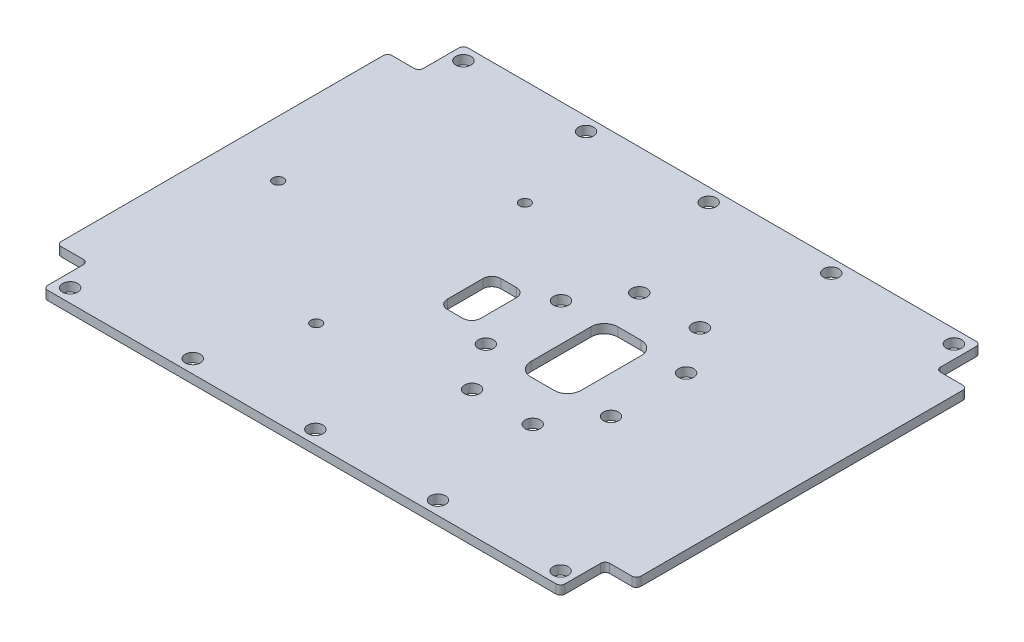
from build123d import *

# Parameters (mm, degrees)
SKETCH_1_W             = 130
SKETCH_1_H             = 94.2
SM_BASE_FLANGE_1_DEPTH = 2
HOLE_WIZARD_M3_1_D     = 3.4
HOLE_WIZARD_M3_2_D     = 3.4
CUT_EXTRUDE_1_REACH    = 82.296
CUT_EXTRUDE_2_REACH    = 82.296
SKETCH_10_W            = 7.464918405
SKETCH_10_H            = 12
FILLET_2_R             = 2
HOLE_WIZARD_M2_1_D     = 2.4
CUT_EXTRUDE_3_DEPTH    = 81.295765766
FILLET_3_R             = 1


# Sheet-metal steps are written as plain solids
with BuildPart() as part:
    # Sketch 1 → 基体-法兰1 (new body)
    with BuildSketch(Plane(origin=(0, 0, 0), x_dir=(1, 0, 0), z_dir=(0, 1, 0))):
        Rectangle(SKETCH_1_W, SKETCH_1_H)
    extrude(amount=-SM_BASE_FLANGE_1_DEPTH)

    # M3 间隙孔1 (through all)
    with Locations(Plane(origin=(0, 0, 0), x_dir=(1, 0, 0), z_dir=(0, 1, 0))):
        with Locations((-55, -44.1), (-27.5, -44.1), (0, -44.1), (27.5, -44.1), (55, -44.1), (55, 44.1), (27.5, 44.1), (0, 44.1), (-27.5, 44.1), (-55, 44.1)):
            Hole(HOLE_WIZARD_M3_1_D / 2)

    # M3 间隙孔2 (through all)
    with Locations(Plane(origin=(0, 0, 0), x_dir=(1, 0, 0), z_dir=(0, 1, 0))):
        with Locations((2.567531914, -8.425296044), (2.567531914, 8.425296044), (9.795, 18.75), (23.395, 18.75), (30.622468086, 8.425296044), (30.622468086, -8.425296044), (23.395, -18.75), (9.795, -18.75)):
            Hole(HOLE_WIZARD_M3_2_D / 2)

    # 草图8 → 切除-拉伸1 (cut, up to next)
    with BuildSketch(Plane(origin=(0, 0, 0), x_dir=(1, 0, 0), z_dir=(0, 1, 0)), mode=Mode.PRIVATE) as cut_extrude_1_sk1:
        with BuildLine():
            Line((19.22, 9.75), (13.97, 9.75))
            ThreePointArc((13.97, 9.75), (11.848679656, 8.871320344), (10.97, 6.75))
            Line((10.97, 6.75), (10.97, -6.75))
            ThreePointArc((10.97, -6.75), (11.848679656, -8.871320344), (13.97, -9.75))
            Line((13.97, -9.75), (19.22, -9.75))
            ThreePointArc((19.22, -9.75), (21.341320344, -8.871320344), (22.22, -6.75))
            Line((22.22, -6.75), (22.22, 6.75))
            ThreePointArc((22.22, 6.75), (21.341320344, 8.871320344), (19.22, 9.75))
        make_face()
    cut_extrude_1_tool1 = extrude(cut_extrude_1_sk1.sketch, amount=-CUT_EXTRUDE_1_REACH, mode=Mode.PRIVATE) & part.part
    add(cut_extrude_1_tool1.solids().sort_by_distance((16.595, 0, 0))[0], mode=Mode.SUBTRACT)

    # 草图10 → 切除-拉伸2 (cut, up to next)
    with BuildSketch(Plane(origin=(0, 0, 0), x_dir=(1, 0, 0), z_dir=(0, 1, 0)), mode=Mode.PRIVATE) as cut_extrude_2_sk1:
        with Locations((-6.762459203, 0)):
            Rectangle(SKETCH_10_W, SKETCH_10_H)
    cut_extrude_2_tool1 = extrude(cut_extrude_2_sk1.sketch, amount=-CUT_EXTRUDE_2_REACH, mode=Mode.PRIVATE) & part.part
    add(cut_extrude_2_tool1.solids().sort_by_distance((-6.762459, 0, 0))[0], mode=Mode.SUBTRACT)

    # 圆角2
    fillet_2_edges = [part.edges().sort_by_distance(p)[0] for p in [
        (-10.494918405, -1, 6),
        (-10.494918405, -1, -6),
        (-3.03, -1, -6),
        (-3.03, -1, 6),
    ]]
    fillet(fillet_2_edges, radius=FILLET_2_R)

    # M2 间隙孔1 (through all)
    with Locations(Plane(origin=(0, 0, 0), x_dir=(1, 0, 0), z_dir=(0, 1, 0))):
        with Locations((-20.514677996, 23.3999532), (-20.514677996, -23.3999532), (-52.431517644, 0)):
            Hole(HOLE_WIZARD_M2_1_D / 2)

    # 草图14 → 切除-拉伸3 (cut, through all)
    with BuildSketch(Plane(origin=(0, 0, 0), x_dir=(1, 0, 0), z_dir=(0, 1, 0))):
        with BuildLine():
            Line((-65, 47.1), (-58, 47.1))
            Line((-58, 47.1), (-58, 38.1))
            ThreePointArc((-58, 38.1), (-58.292893219, 37.392893219), (-59, 37.1))
            Line((-59, 37.1), (-65, 37.1))
            Line((-65, 37.1), (-65, 47.1))
        make_face()
        with BuildLine():
            Line((-58, -47.1), (-58, -38.1))
            ThreePointArc((-58, -38.1), (-58.292893219, -37.392893219), (-59, -37.1))
            Line((-59, -37.1), (-65, -37.1))
            Line((-65, -37.1), (-65, -47.1))
            Line((-65, -47.1), (-58, -47.1))
        make_face()
        with BuildLine():
            Line((65, -47.1), (58, -47.1))
            Line((58, -47.1), (58, -38.1))
            ThreePointArc((58, -38.1), (58.292893219, -37.392893219), (59, -37.1))
            Line((59, -37.1), (65, -37.1))
            Line((65, -37.1), (65, -47.1))
        make_face()
        with BuildLine():
            Line((58, 47.1), (58, 38.1))
            ThreePointArc((58, 38.1), (58.292893219, 37.392893219), (59, 37.1))
            Line((59, 37.1), (65, 37.1))
            Line((65, 37.1), (65, 47.1))
            Line((65, 47.1), (58, 47.1))
        make_face()
    extrude(amount=-CUT_EXTRUDE_3_DEPTH, mode=Mode.SUBTRACT)

    # 圆角3
    fillet_3_edges = [part.edges().sort_by_distance(p)[0] for p in [
        (58, -1, -47.1),
        (65, -1, -37.1),
        (65, -1, 37.1),
        (58, -1, 47.1),
        (-58, -1, 47.1),
        (-65, -1, 37.1),
        (-65, -1, -37.1),
        (-58, -1, -47.1),
    ]]
    fillet(fillet_3_edges, radius=FILLET_3_R)


solid = part.part
